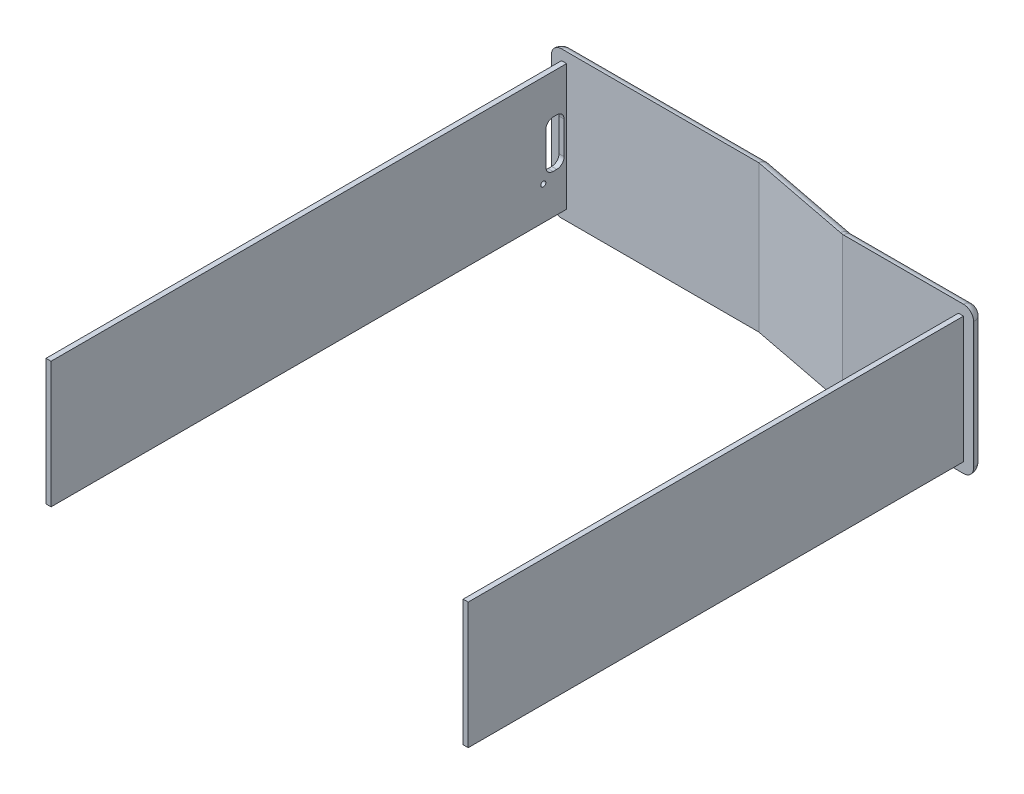
from build123d import *

# Parameters (mm, degrees)
BOSS_EXTRUDE1_DEPTH = 29
SKETCH2_W           = 1
SKETCH2_H           = 24.95
BOSS_EXTRUDE2_DEPTH = 100
SKETCH4_W           = 1
SKETCH4_H           = 24.95
BOSS_EXTRUDE3_DEPTH = 101.96257304
CUT_EXTRUDE1_DEPTH  = 1
SKETCH6_R           = 0.498897706
CUT_EXTRUDE2_DEPTH  = 1
FILLET1_R           = 2


with BuildPart() as part:
    # Sketch1 → Boss-Extrude1 (new body)
    with BuildSketch(Plane(origin=(0, 0, 0), x_dir=(1, 0, 0), z_dir=(0, 1, 0))):
        Polygon((-20.5, 0), (20.5, 0), (41.08, -4), (47.08, -4), (67, -4), (67, -1.96257304), (47.08, -1.96257304), (41.08, -1.96257304), (20.69256171, 2), (-20.5, 2), align=None)
    extrude(amount=BOSS_EXTRUDE1_DEPTH)

    # Sketch2 → Boss-Extrude2 (add)
    with BuildSketch(Plane(origin=(0, 0, 1.96257304), x_dir=(-1, 0, 0), z_dir=(0, 0, -1))):
        with Locations((-64.5, 14.5)):
            Rectangle(SKETCH2_W, SKETCH2_H)
    extrude(amount=-BOSS_EXTRUDE2_DEPTH)

    # Sketch4 → Boss-Extrude3 (add)
    with BuildSketch(Plane.XY):
        with Locations((-18, 14.5)):
            Rectangle(SKETCH4_W, SKETCH4_H)
    extrude(amount=BOSS_EXTRUDE3_DEPTH)

    # Sketch5 → Cut-Extrude1 (cut)
    with BuildSketch(Plane.ZY.offset(18.5)):
        with BuildLine():
            Line((1.95, 19.17), (2.66, 19.17))
            ThreePointArc((2.66, 19.17), (3.685304833, 18.745304833), (4.11, 17.72))
            Line((4.11, 17.72), (4.11, 11.28))
            ThreePointArc((4.11, 11.28), (3.685304833, 10.254695167), (2.66, 9.83))
            Line((2.66, 9.83), (1.95, 9.83))
            ThreePointArc((1.95, 9.83), (0.924695167, 10.254695167), (0.5, 11.28))
            Line((0.5, 11.28), (0.5, 17.72))
            ThreePointArc((0.5, 17.72), (0.924695167, 18.745304833), (1.95, 19.17))
        make_face()
    extrude(amount=-CUT_EXTRUDE1_DEPTH, mode=Mode.SUBTRACT)

    # Sketch6 → Cut-Extrude2 (cut)
    with BuildSketch(Plane.ZY.offset(18.5)):
        with Locations(Location((4.61, 8.645, 0), (0, 0, 270))):
            Circle(SKETCH6_R)
    extrude(amount=-CUT_EXTRUDE2_DEPTH, mode=Mode.SUBTRACT)

    # Fillet1
    fillet1_edges = [part.edges().sort_by_distance(p)[0] for p in [
        (0.096280855, 0, -2),
        (30.886280855, 0, -0.01871348),
        (54.04, 0, 1.96257304),
        (67, 0, 2.98128652),
        (-20.5, 0, -1),
        (-20.5, 14.5, -2),
        (20.69256171, 14.5, -2),
        (41.08, 14.5, 1.96257304),
        (67, 14.5, 1.96257304),
        (67, 29, 2.98128652),
        (54.04, 29, 1.96257304),
        (30.886280855, 29, -0.01871348),
        (0.096280855, 29, -2),
        (-20.5, 29, -1),
    ]]
    fillet(fillet1_edges, radius=FILLET1_R - 0.0001)  # a hair under: the kernel refuses the full size


solid = part.part
